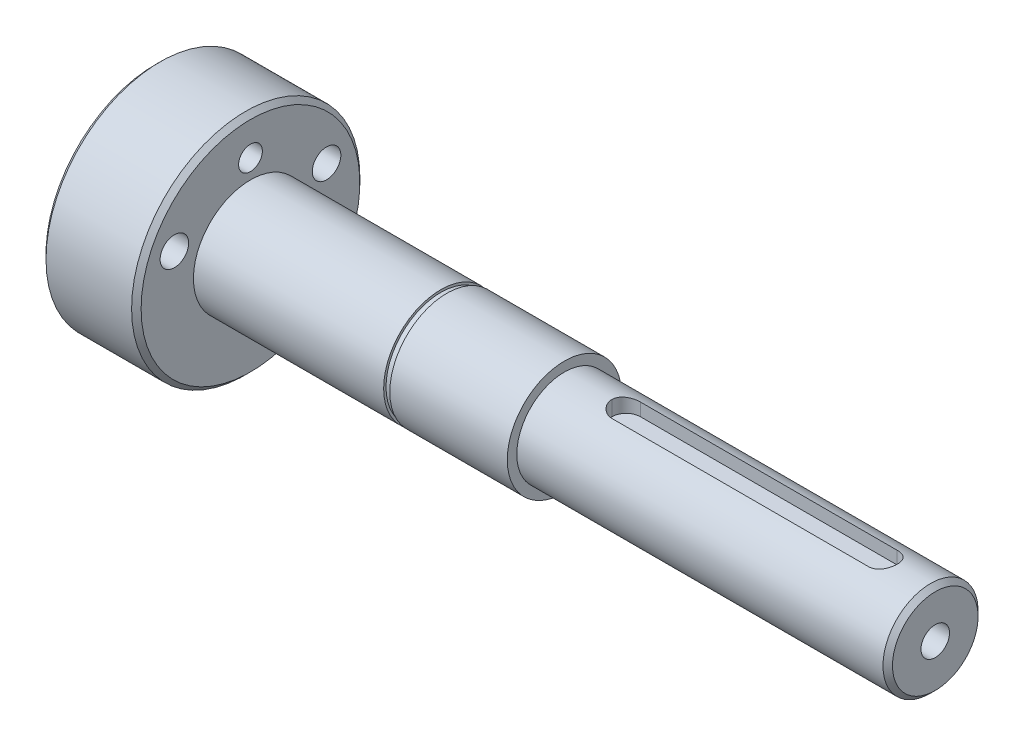
from build123d import *

# Parameters (mm, degrees)
PER_AGE1_D              = 5
PER_AGE1_DEPTH          = 17
PER_AGE1_CBORE_D        = 6
PER_AGE1_CBORE_DEPTH    = 12
PER_AGE1_TIP            = 1.502151548
ESQUISSE6_W             = 1.3
ESQUISSE6_H             = 0.5
ESQUISSE5_W             = 60
ESQUISSE5_H             = 3.145636389
ENL_V_MAT_EXTRU_1_DEPTH = 3
CONG_1_R                = 3
CHANFREIN1_SIZE         = 1
ESQUISSE7_R             = 3
ESQUISSE7_R_2           = 2.5
ENL_V_MAT_EXTRU_2_DEPTH = 168.475371324


with BuildPart() as part:
    # Esquisse1 → Base-Révolution (revolve)
    with BuildSketch(Plane.XY, mode=Mode.PRIVATE) as base_r_volution_sk:
        Polygon((0, 0), (0, 24), (20, 24), (20, 12), (86, 12), (86, 10), (164, 10), (164, 0), align=None)
    revolve(base_r_volution_sk.sketch.rotate(Axis((0, 0, 0), (1, 0, 0)), 90), axis=Axis((0, 0, 0), (1, 0, 0)))

    # Perçage1
    with Locations(Plane(origin=(164, 0, 0), x_dir=(0, 0, -1), z_dir=(1, 0, 0))):
        with Locations((0, 0)):
            CounterBoreHole(PER_AGE1_D / 2, PER_AGE1_CBORE_D / 2, PER_AGE1_CBORE_DEPTH, depth=PER_AGE1_DEPTH)
            with Locations((0, 0, -(PER_AGE1_DEPTH + PER_AGE1_TIP / 2))):  # 118° drill point
                Cone(0, PER_AGE1_D / 2, PER_AGE1_TIP, mode=Mode.SUBTRACT)

    # Esquisse6 → Enlèvement de matière-Révolution1 (revolve, cut)
    with BuildSketch(Plane.XY, mode=Mode.PRIVATE) as enl_vement_de_mati_re_r_volution1_sk:
        with Locations((60.65, 11.75)):
            Rectangle(ESQUISSE6_W, ESQUISSE6_H)
    revolve(enl_vement_de_mati_re_r_volution1_sk.sketch.rotate(Axis((0, 0, 0), (1, 0, 0)), 90), axis=Axis((0, 0, 0), (1, 0, 0)), mode=Mode.SUBTRACT)

    # Esquisse5 → Enlèv. mat.-Extru.1 (cut, symmetric)
    with BuildSketch(Plane.XY):
        with Locations((126, 8.427181806)):
            Rectangle(ESQUISSE5_W, ESQUISSE5_H)
    extrude(amount=ENL_V_MAT_EXTRU_1_DEPTH, both=True, mode=Mode.SUBTRACT)

    # Congé1
    cong_1_edges = [part.edges().sort_by_distance(p)[0] for p in [
        (96, 8.196877813, 3),
        (156, 8.196877813, 3),
        (156, 8.196877813, -3),
        (96, 8.196877813, -3),
    ]]
    fillet(cong_1_edges, radius=CONG_1_R - 0.0001)  # a hair under: the kernel refuses the full size

    # Chanfrein1
    chanfrein1_edges = [part.edges().sort_by_distance(p)[0] for p in [
        (164, 0, -10),
        (20, 0, -24),
        (0, 0, -24),
    ]]
    chamfer(chanfrein1_edges, length=CHANFREIN1_SIZE)

    # Esquisse7 → Enlèv. mat.-Extru.2 (cut, through all)
    with BuildSketch(Plane.ZY):
        with Locations((-16, 7)):
            Circle(ESQUISSE7_R)
        with Locations((16, 7)):
            Circle(ESQUISSE7_R)
        with Locations((0, 16)):
            Circle(ESQUISSE7_R_2)
    extrude(amount=-ENL_V_MAT_EXTRU_2_DEPTH, mode=Mode.SUBTRACT)


solid = part.part
